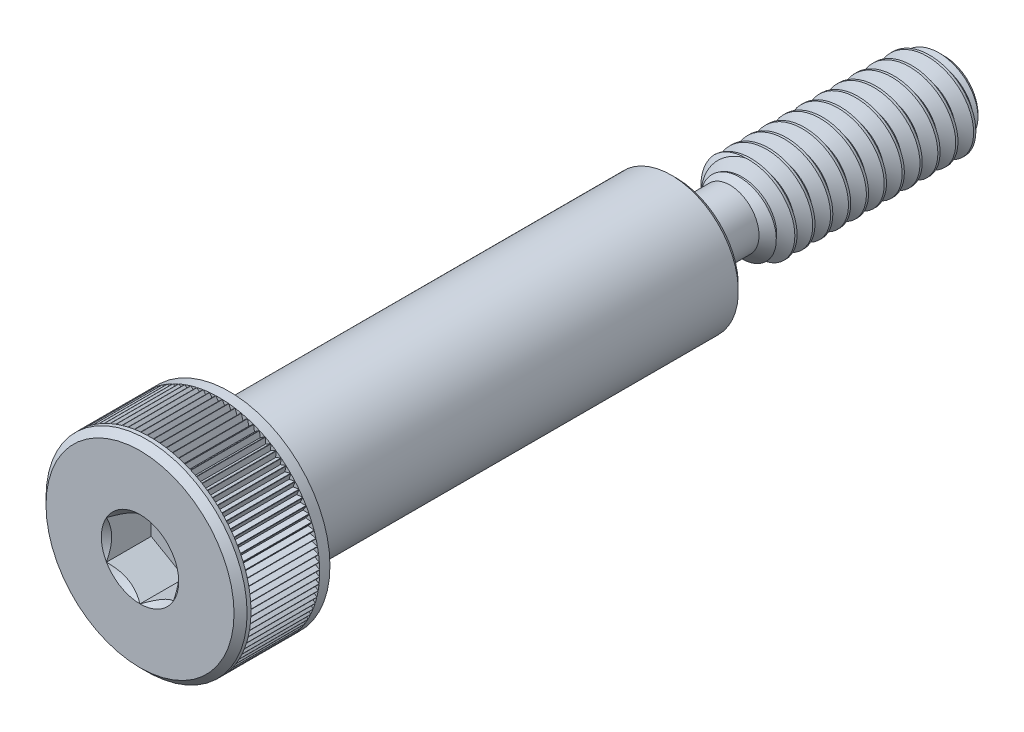
from build123d import *

# Parameters (mm, degrees)
SKETCH12_R          = 3.175
BOSS_EXTRUDE1_DEPTH = 19.05
CHAMFER1_SIZE       = 0.79375
CHAMFER2_SIZE       = 0.46434375
FILLET1_R           = 0.3175
CUT_EXTRUDE2_DEPTH  = 3.175
CUT_SWEEP1_PITCH    = 1.27
SKETCH14_R          = 1.5875
BOSS_EXTRUDE2_DEPTH = 17.145
CUT_EXTRUDE5_DEPTH  = 2.439590625
CIRPATTERN1_COUNT   = 99


with BuildPart() as part:
    # Sketch13 → Revolve1 (revolve)
    with BuildSketch(Plane(origin=(0, 0, 0), x_dir=(0, 0, -1), z_dir=(1, 0, 0)), mode=Mode.PRIVATE) as revolve1_sk:
        Polygon((0, 0), (0, 7.14375), (6.35, 7.14375), (6.35, 4.4053125), (7.62, 4.4053125), (7.9771875, 4.7625), (37.7428125, 4.7625), (38.1, 4.4053125), (38.1, 0), align=None)
    revolve(revolve1_sk.sketch.rotate(Axis((0, 0, -38.1), (0, 0, 1)), 90), axis=Axis((0, 0, -38.1), (0, 0, 1)))

    # Sketch12 → Boss-Extrude1 (add)
    with BuildSketch(Plane(origin=(0, 0, -38.1), x_dir=(-1, 0, 0), z_dir=(0, 0, -1))):
        Circle(SKETCH12_R)
    extrude(amount=BOSS_EXTRUDE1_DEPTH)

    # Sketch5 → Cut-Revolve1 (revolve, cut)
    with BuildSketch(Plane(origin=(0, 0, 0), x_dir=(0, 0, -1), z_dir=(1, 0, 0))):
        Polygon((38.1, 3.175), (43.02125, 3.175), (41.91, 2.06375), (38.1, 2.06375), align=None)
    revolve(axis=Axis((0, 0, -38.1), (0, 0, 1)), mode=Mode.SUBTRACT)

    # Chamfer1
    chamfer1_edges = [part.edges().sort_by_distance(p)[0] for p in [
        (3.175, 0, -57.15),
    ]]
    chamfer(chamfer1_edges, length=CHAMFER1_SIZE)

    # Chamfer2
    chamfer2_edges = [part.edges().sort_by_distance(p)[0] for p in [
        (7.14375, 0, 0),
    ]]
    chamfer(chamfer2_edges, length=CHAMFER2_SIZE)

    # Fillet1
    fillet1_edges = [part.edges().sort_by_distance(p)[0] for p in [
        (0, -2.06375, -38.1),
    ]]
    fillet(fillet1_edges, radius=FILLET1_R)

    # Sketch8 → Cut-Extrude2 (cut)
    with BuildSketch(Plane.XY):
        Polygon((2.38125, 1.374815329), (0, 2.749630657), (-2.38125, 1.374815329), (-2.38125, -1.374815329), (0, -2.749630657), (2.38125, -1.374815329), align=None)
    extrude(amount=-CUT_EXTRUDE2_DEPTH, mode=Mode.SUBTRACT)

    # Cut-Extrude4 cone 1 section (through the dimple's axis) → Cut-Extrude4 (revolve, cut)
    with BuildSketch(Plane(origin=(0, 0, 0), x_dir=(0, -1, 0), z_dir=(1, 0, 0))):
        Polygon((0, 0), (2.749630657, 0), (0, 2.749630657), align=None)
    revolve(axis=Axis((0, 0, 0), (0, 0, -1)), mode=Mode.SUBTRACT)


with BuildPart() as body_2:
    # Split1: the piece on the far side of the plane
    add(part.part)
    split(bisect_by=Plane.XY.offset(-38.1), keep=Keep.BOTTOM)

    # Cut-Sweep1: arcs per turn and ends read off the stored shape
    # Cut-Sweep1: the profile of Sketch4 screwed along a right-hand helix through 14 turns, 8 arcs to a turn; built about Z, then put on its axis
    cut_sweep1_z = Axis((0, 0, 0), (0, 0, 1))
    cut_sweep1_corners = [(2.350110803, 0, -0.47625), (2.350110803, 0, -0.635), (3.243740766, 0, -1.1509375), (3.243740766, 0, -0.555625), (3.243740766, 0, 0.0396875)]
    with BuildLine(mode=Mode.PRIVATE) as cut_sweep1_profile:
        Line(cut_sweep1_corners[0], cut_sweep1_corners[1])
        Line(cut_sweep1_corners[1], cut_sweep1_corners[2])
        Line(cut_sweep1_corners[2], cut_sweep1_corners[3])
        Line(cut_sweep1_corners[3], cut_sweep1_corners[4])
        Line(cut_sweep1_corners[4], cut_sweep1_corners[0])
    cut_sweep1_cap = Face(cut_sweep1_profile.wire())
    cut_sweep1_turn_angles = [0, 22.5, 45, 67.5, 90, 112.5, 135, 157.5, 180, 202.5, 225, 247.5, 270, 292.5, 315, 337.5, 360]
    cut_sweep1_turn_weights = [1, 0.9238795325112867, 1, 0.9238795325112867, 1, 0.9238795325112867, 1, 0.9238795325112867, 1, 0.9238795325112867, 1, 0.9238795325112867, 1, 0.9238795325112867, 1, 0.9238795325112867, 1]
    cut_sweep1_turn_rails = [Edge.make_bspline([Vector(p[0], p[1], 0).rotate(cut_sweep1_z, cut_sweep1_turn_angles[k]) / cut_sweep1_turn_weights[k] + Vector(0, 0, p[2] + CUT_SWEEP1_PITCH * cut_sweep1_turn_angles[k] / 360) for k in range(17)], [0, 0, 0, 1, 1, 2, 2, 3, 3, 4, 4, 5, 5, 6, 6, 7, 7, 8, 8, 8], 2, cut_sweep1_turn_weights) for p in cut_sweep1_corners]
    cut_sweep1_turn_sides = [Face.make_surface_from_curves(cut_sweep1_turn_rails[p[0]], cut_sweep1_turn_rails[p[1]]) for p in [(0, 1), (1, 2), (2, 3), (3, 4), (4, 0)]]
    cut_sweep1 = Plane(origin=(0, 0, -57.15), x_dir=(0, 1, 0), z_dir=(0, 0, 1)) * Solid(Shell([*[p.moved(Location((0, 0, CUT_SWEEP1_PITCH * i))) for i in range(14) for p in cut_sweep1_turn_sides], cut_sweep1_cap, cut_sweep1_cap.rotate(cut_sweep1_z, 5040).moved(Location((0, 0, CUT_SWEEP1_PITCH * 5040 / 360)))]))
    add(cut_sweep1, mode=Mode.SUBTRACT)


with BuildPart() as part_1:
    add(part.part)

    # Split1
    split(bisect_by=Plane.XY.offset(-38.1), keep=Keep.TOP)

    add(body_2.part)  # Boss-Extrude2 merges body 2
    # Sketch14 → Boss-Extrude2 (add)
    with BuildSketch(Plane(origin=(0, 0, -38.1), x_dir=(-1, 0, 0), z_dir=(0, 0, -1))):
        Circle(SKETCH14_R)
    extrude(amount=BOSS_EXTRUDE2_DEPTH)

    # Sketch11 → Cut-Extrude5 (cut, symmetric)
    with BuildSketch(Plane.XY.offset(-3.175)):
        Polygon((0, 6.772275), (0.214471191, 7.14375), (-0.214471191, 7.14375), align=None)
    cut_extrude5 = extrude(amount=CUT_EXTRUDE5_DEPTH, both=True, mode=Mode.SUBTRACT)

    # CirPattern1: Cut-Extrude5 ×99 about axis
    cirpattern1_axis = Axis((0, 0, 0), (0, 0, 1))
    for i in range(1, CIRPATTERN1_COUNT):
        add(cut_extrude5.rotate(cirpattern1_axis, i * 360 / CIRPATTERN1_COUNT), mode=Mode.SUBTRACT)


solid = part_1.part
